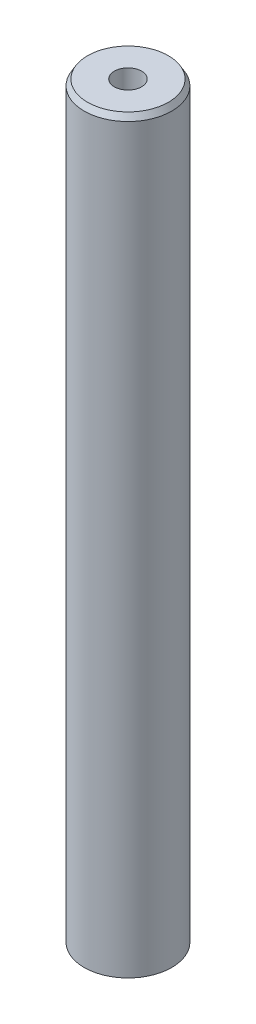
from build123d import *
from OCP.BRepFilletAPI import BRepFilletAPI_MakeChamfer

# Parameters (mm, degrees)
SKETCH1_R           = 35
BOSS_EXTRUDE1_DEPTH = 600
SKETCH2_R           = 10.883090648
CUT_EXTRUDE1_DEPTH  = 603.038204768
CHAMFER1_SIZE       = 4.723014784
CHAMFER1_SIZE2      = 2.726833857


with BuildPart() as part:
    # Sketch1 → Boss-Extrude1 (new body)
    with BuildSketch(Plane(origin=(0, 0, 0), x_dir=(1, 0, 0), z_dir=(0, 1, 0))):
        Circle(SKETCH1_R)
    extrude(amount=BOSS_EXTRUDE1_DEPTH)

    # Sketch2 → Cut-Extrude1 (cut, through all)
    with BuildSketch(Plane(origin=(0, 0, 0), x_dir=(1, 0, 0), z_dir=(0, 1, 0))):
        Circle(SKETCH2_R)
    extrude(amount=CUT_EXTRUDE1_DEPTH, mode=Mode.SUBTRACT)

    # Chamfer1: one chamfer whose edges measure the first distance from different faces: ONE call of the kernel's chamfer builder (chamfer() names one face for all edges)
    chamfer1_edges_1 = [part.edges().sort_by_distance(p)[0] for p in [
        (-35, 600, 0),
    ]]
    chamfer1_side_1 = [part.faces().sort_by_distance(p)[0] for p in [
        (-35, 300, 0),
    ]]
    chamfer1_edges_2 = [part.edges().sort_by_distance(p)[0] for p in [
        (-35, 0, 0),
    ]]
    chamfer1_side_2 = [part.faces().sort_by_distance(p)[0] for p in [
        (-34.010050506, 0, 0),
    ]]
    chamfer1 = BRepFilletAPI_MakeChamfer(part.part.solid().wrapped)
    for e in chamfer1_edges_1:
        chamfer1.Add(CHAMFER1_SIZE, CHAMFER1_SIZE2, e.wrapped, chamfer1_side_1[0].wrapped)  # the first distance lies on this face
    for e in chamfer1_edges_2:
        chamfer1.Add(CHAMFER1_SIZE, CHAMFER1_SIZE2, e.wrapped, chamfer1_side_2[0].wrapped)  # the first distance lies on this face
    add(Compound.cast(chamfer1.Shape()), mode=Mode.REPLACE)


solid = part.part
